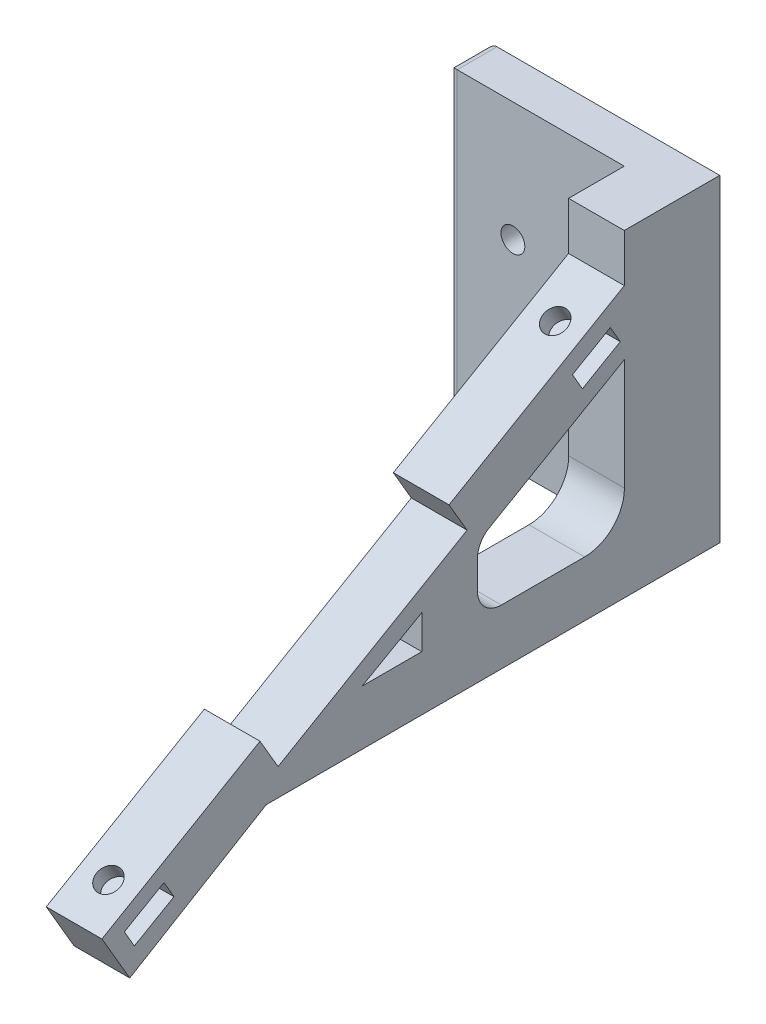
from build123d import *

# Parameters (mm, degrees)
BOSS_EXTRUDE1_DEPTH = 7
FILLET1_R           = 3
FILLET2_R           = 5
SKETCH2_W           = 5
SKETCH2_H           = 40
BOSS_EXTRUDE2_DEPTH = 22
SKETCH4_R           = 1.5
CUT_EXTRUDE1_DEPTH  = 3
SKETCH5_R           = 1.5
CUT_EXTRUDE2_DEPTH  = 5
FILLET3_R           = 1


with BuildPart() as part:
    # Sketch1 → Boss-Extrude1 (new body)
    with BuildSketch(Plane(origin=(0, 0, 0), x_dir=(0, 0, -1), z_dir=(1, 0, 0))):
        Polygon((-21.785617828, -17.377868865), (35.214382172, -17.377868865), (35.214382172, 22.622131135), (23.214382172, 22.622131135), (23.214382172, 16.622131135), (1.187686697, 3.773991719), (3.455005417, -0.113072189), (-20.299274017, -13.968908814), (-22.566592737, -10.081844907), (-42.433808264, -21.670362811), (-38.937098948, -27.665079148), align=None)
        Polygon((23.234116709, 8.569586546), (23.234116709, -10.417868865), (4.764740561, -10.417868865), (4.764740561, -1.399885987), (6.011600394, -1.399885987), align=None, mode=Mode.SUBTRACT)
        Polygon((-39.613886954, -22.304550046), (-34.634489281, -19.42911985), (-33.384302239, -21.59407536), (-38.363699913, -24.469505556), align=None, mode=Mode.SUBTRACT)
        Polygon((-9.735540794, -10.497868865), (-2.235259439, -10.497868865), (-2.235259439, -6.248372162), align=None, mode=Mode.SUBTRACT)
        Polygon((16.699385829, 10.182861543), (17.951839541, 8.019216032), (22.7118599, 10.774614335), (21.459406188, 12.938259845), align=None, mode=Mode.SUBTRACT)
    extrude(amount=-BOSS_EXTRUDE1_DEPTH)

    # Fillet1
    # the kernel refuses this fillet: 3 mm, written as the material it adds along each edge
    with BuildSketch(Plane(origin=(0, -10.417868865, -4.764740561), x_dir=(0, 0, -1), z_dir=(-1, 0, 0))) as fillet1_piece_1:
        with BuildLine():
            CenterArc((FILLET1_R, -FILLET1_R), FILLET1_R, 90, 90)
            Line((0, -FILLET1_R), (-FILLET1_R * 0.02, -FILLET1_R))
            Line((-FILLET1_R * 0.02, -FILLET1_R), (-FILLET1_R * 0.02, FILLET1_R * 0.02))
            Line((-FILLET1_R * 0.02, FILLET1_R * 0.02), (FILLET1_R, FILLET1_R * 0.02))
            Line((FILLET1_R, FILLET1_R * 0.02), (FILLET1_R, 0))
        make_face()
    extrude(amount=7)
    with BuildSketch(Plane(origin=(0, -1.399885987, -4.764740561), x_dir=(0, -1, 0), z_dir=(-1, 0, 0))) as fillet1_piece_2:
        with BuildLine():
            CenterArc((2.434440295, -3), FILLET1_R, 90, 54.240794128)
            Line((0, -1.246859832), (-0.048688806, -1.211797029))
            ThreePointArc((-0.048688806, -1.211797029), (-0.06, -0.623429916), (-0.06, 0))
            Line((-0.06, 0), (0, 0.06))
            Line((0, 0.06), (2.434440295, 0.06))
            Line((2.434440295, 0.06), (2.434440295, 0))
        make_face()
    extrude(amount=7)

    # Fillet2
    fillet2_edges = [part.edges().sort_by_distance(p)[0] for p in [
        (-3.5, -10.417868865, -23.234116709),
    ]]
    fillet(fillet2_edges, radius=FILLET2_R)

    # Sketch2 → Boss-Extrude2 (add)
    with BuildSketch(Plane.ZY.offset(7)):
        with Locations((-32.714382172, 2.622131135)):
            Rectangle(SKETCH2_W, SKETCH2_H)
    extrude(amount=BOSS_EXTRUDE2_DEPTH)

    # Sketch4 → Cut-Extrude1 (cut)
    with BuildSketch(Plane(origin=(0, 2.299007828, 1.341007921), x_dir=(1, 0, 0), z_dir=(0, 0.8637919794098133, 0.5038486045502921))):
        with Locations(Location((-3.5, 22.427434704, 0), (0, 0, 270))):
            Circle(SKETCH4_R)
        with Locations(Location((-3.5, -42.572565296, 0), (0, 0, 270))):
            Circle(SKETCH4_R)
    extrude(amount=-CUT_EXTRUDE1_DEPTH, mode=Mode.SUBTRACT)

    # Sketch5 → Cut-Extrude2 (cut)
    with BuildSketch(Plane.XY.offset(-30.214382172)):
        with Locations((-21, 7.622131135)):
            Circle(SKETCH5_R)
        with Locations((-21, -12.377868865)):
            Circle(SKETCH5_R)
    extrude(amount=-CUT_EXTRUDE2_DEPTH, mode=Mode.SUBTRACT)

    # Fillet3
    fillet3_edges = [part.edges().sort_by_distance(p)[0] for p in [
        (-29, 2.622131135, -35.214382172),
        (-29, -17.377868865, -32.714382172),
        (-29, 2.622131135, -30.214382172),
        (-29, 22.622131135, -32.714382172),
    ]]
    fillet(fillet3_edges, radius=FILLET3_R)


solid = part.part
